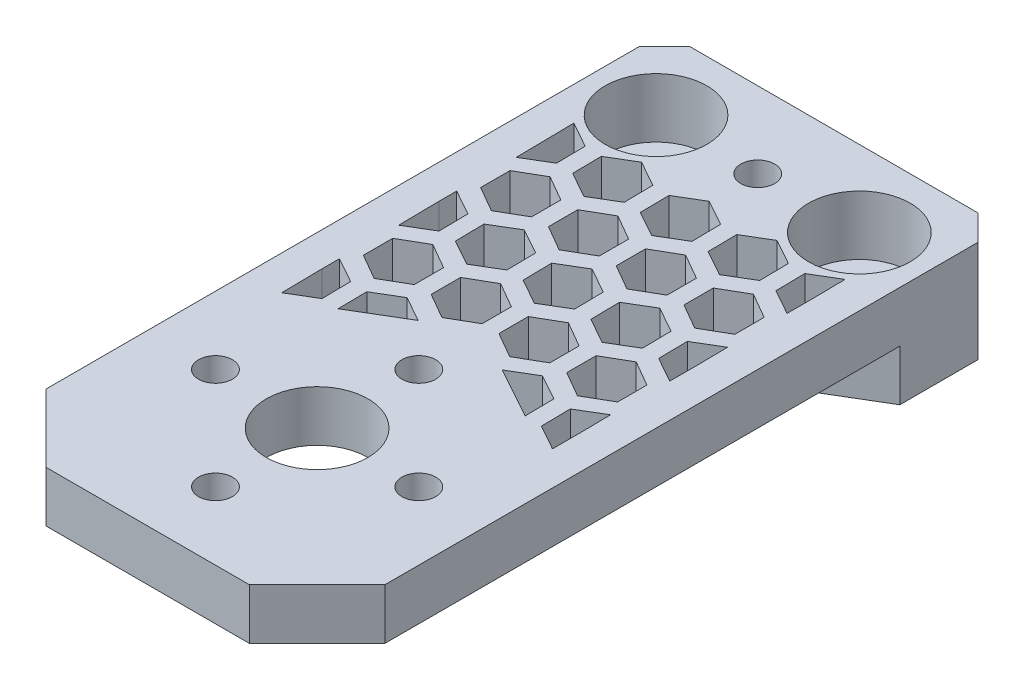
from build123d import *
from build123d.topology import SkipClean

# Parameters (mm, degrees)
SKETCH2_W                = 20
SKETCH2_H                = 44
SKETCH2_R                = 1.5
SKETCH2_R_2              = 3
SKETCH2_R_3              = 1
BOSS_EXTRUDE1_DEPTH      = 3
CHAMFER2_SIZE            = 4
BOSS_EXTRUDE3_START      = 3
SKETCH5_W                = 20
SKETCH5_H                = 12
SKETCH5_R                = 1.5
BOSS_EXTRUDE3_DEPTH      = 3
CHAMFER3_SIZE            = 5
CHAMFER4_SIZE            = 3.5
CHAMFER5_SIZE            = 2
SKETCH8_W                = 16
SKETCH8_H                = 3
BOSS_EXTRUDE4_DEPTH      = 3.5
CUT_EXTRUDE14_DEPTH      = 20.5
CUT_EXTRUDE12_DEPTH      = 20.5
CUT_EXTRUDE12_DEPTH_BACK = 3.5
SKETCH7_R                = 3
CUT_EXTRUDE13_DEPTH      = 3.5
CUT_EXTRUDE15_DEPTH      = 8.5
BOSS_EXTRUDE5_START      = 0.55
SKETCH11_R               = 2.4
SKETCH11_R_2             = 1.5
BOSS_EXTRUDE5_DEPTH      = 0.55


with BuildPart() as part:
    # Sketch2 → Boss-Extrude1 (new body)
    with BuildSketch(Plane(origin=(0, 0, 0), x_dir=(1, 0, 0), z_dir=(0, 1, 0))):
        with Locations((0, 12)):
            Rectangle(SKETCH2_W, SKETCH2_H)
        with Locations(Location((-6, 26, 0), (0, 0, 270))):
            Circle(SKETCH2_R, mode=Mode.SUBTRACT)
        with Locations(Location((6, 26, 0), (0, 0, 270))):
            Circle(SKETCH2_R, mode=Mode.SUBTRACT)
        with Locations(Location((0, 0, 0), (0, 0, 270))):
            Circle(SKETCH2_R_2, mode=Mode.SUBTRACT)
        with Locations(Location((0, 26, 0), (0, 0, 270))):
            Circle(SKETCH2_R_3, mode=Mode.SUBTRACT)
        with Locations(Location((-6, 0, 0), (0, 0, 270))):
            Circle(SKETCH2_R_3, mode=Mode.SUBTRACT)
        with Locations(Location((0, 6, 0), (0, 0, 270))):
            Circle(SKETCH2_R_3, mode=Mode.SUBTRACT)
        with Locations(Location((6, 0, 0), (0, 0, 270))):
            Circle(SKETCH2_R_3, mode=Mode.SUBTRACT)
        with Locations(Location((0, -6, 0), (0, 0, 270))):
            Circle(SKETCH2_R_3, mode=Mode.SUBTRACT)
    extrude(amount=BOSS_EXTRUDE1_DEPTH)

    # Chamfer2
    chamfer2_edges = [part.edges().sort_by_distance(p)[0] for p in [
        (10, 1.5, 10),
        (-10, 1.5, 10),
    ]]
    chamfer(chamfer2_edges, length=CHAMFER2_SIZE)

    # Sketch5 → Boss-Extrude3 (add)
    with SkipClean():  # the faces are left unmerged after this step: merging them gives an invalid solid
        with BuildSketch(Plane.XZ.offset(BOSS_EXTRUDE3_START)):
            with Locations((0, -28)):
                Rectangle(SKETCH5_W, SKETCH5_H)
            with Locations(Location((-6, -26, 0), (0, 0, 270))):
                Circle(SKETCH5_R, mode=Mode.SUBTRACT)
            with Locations(Location((6, -26, 0), (0, 0, 270))):
                Circle(SKETCH5_R, mode=Mode.SUBTRACT)
        extrude(amount=-BOSS_EXTRUDE3_DEPTH)

    # Chamfer3
    chamfer3_edges = [part.edges().sort_by_distance(p)[0] for p in [
        (-10, 1.5, -34),
        (10, 1.5, -34),
    ]]
    chamfer(chamfer3_edges, length=CHAMFER3_SIZE)

    # Chamfer4
    # the kernel refuses this chamfer: 3.5 mm, written as the material it takes off along each edge
    with BuildSketch(Plane(origin=(-14.000890458, 3, -34), x_dir=(0, 0.027495876610586372, 0.9996219169112968), z_dir=(1, 0, 0))) as chamfer4_piece_1:
        Polygon((CHAMFER4_SIZE * 0.999621916911, CHAMFER4_SIZE * 0.0274958766106), (-CHAMFER4_SIZE * 0.0274958766106, CHAMFER4_SIZE * 0.999621916911), (0, 0), align=None)
    extrude(amount=28.001780916, mode=Mode.SUBTRACT)

    # Chamfer5
    chamfer5_edges = [part.edges().sort_by_distance(p)[0] for p in [
        (-10, -1.5, -22),
        (10, -1.5, -22),
    ]]
    chamfer(chamfer5_edges, length=CHAMFER5_SIZE)

    # Sketch8 → Boss-Extrude4 (add)
    with BuildSketch(Plane.XY.offset(-22)):
        with Locations((0, -1.5)):
            Rectangle(SKETCH8_W, SKETCH8_H)
    extrude(amount=BOSS_EXTRUDE4_DEPTH)

    # Sketch9 → Cut-Extrude14 (cut)
    with BuildSketch(Plane(origin=(8, 0, 0), x_dir=(0, 0, -1), z_dir=(1, 0, 0))):
        Polygon((18.5, 0), (22, -3), (18.5, -3), align=None)
    extrude(amount=-CUT_EXTRUDE14_DEPTH, mode=Mode.SUBTRACT)

    # Sketch6 → Cut-Extrude12 (cut, two sides: drawn at the far end of the back side and taken through both)
    with BuildSketch(Plane.XZ.offset(-CUT_EXTRUDE12_DEPTH_BACK)):
        Polygon((7.974958559, -9.340270184), (8, -7.600608544), (8, -5.890509536), (6.512677497, -6.720778994), (6.487859457, -8.43719837), (6.487636056, -8.452648771), align=None)
        Polygon((-7.965068215, -19.71653063), (-8.015151096, -23.16468646), (-6.502787152, -22.320438095), (-6.477969112, -20.604018719), align=None)
        Polygon((-5.972485973, -16.256349599), (-7.472485973, -17.122375003), (-7.472485973, -18.854425811), (-5.972485973, -19.720451214), (-4.472485973, -18.854425811), (-4.472485973, -17.122375003), align=None)
        Polygon((-8, -15.196834392), (-8, -16.236228649), (-6.502787152, -15.400438095), (-6.477745712, -13.668568317), (-7.965068215, -12.780946905), align=None)
        Polygon((-5.482377331, -20.560778994), (-5.507195371, -22.27719837), (-4.020096269, -23.16468646), (-2.507732325, -22.320438095), (-2.482914284, -20.604018719), (-3.970013387, -19.71653063), align=None)
        Polygon((-0.472485973, -18.854425811), (-0.472485973, -17.122375003), (-1.972485973, -16.256349599), (-3.472485973, -17.122375003), (-3.472485973, -18.854425811), (-1.972485973, -19.720451214), align=None)
        Polygon((8, -21.440608545), (8, -19.730509537), (6.512677497, -20.560778994), (6.487859457, -22.27719837), (6.487636056, -22.292648772), (7.974958559, -23.180270185), align=None)
        Polygon((-8, -8.292418116), (-8, -9.316228649), (-6.502787152, -8.480438095), (-6.477969112, -6.764018718), (-7.965068215, -5.876530629), align=None)
        Polygon((-1.487322503, -20.560778994), (-1.512140543, -22.27719837), (-0.025041441, -23.16468646), (1.487322503, -22.320438095), (1.512140543, -20.604018719), (0.025041441, -19.71653063), align=None)
        Polygon((-0.025041441, -16.24468646), (1.487322503, -15.400438095), (1.512140543, -13.684018718), (0.025041441, -12.796530629), (-1.487322503, -13.640778994), (-1.512140543, -15.35719837), align=None)
        Polygon((0.527514027, -17.122375003), (0.527514027, -18.854425811), (2.027514027, -19.720451214), (3.527514027, -18.854425811), (3.527514027, -17.122375003), (2.027514027, -16.256349599), align=None)
        Polygon((5.487322503, -22.320438095), (5.512140543, -20.604018719), (4.025041441, -19.71653063), (2.512677497, -20.560778994), (2.487859457, -22.27719837), (3.974958559, -23.16468646), align=None)
        Polygon((6.027514027, -19.720451214), (7.527514027, -18.854425811), (7.527514027, -17.122375003), (6.027514027, -16.256349599), (4.527514027, -17.122375003), (4.527514027, -18.854425811), align=None)
        Polygon((7.974958559, -16.24468646), (8, -14.512816682), (8, -12.810509536), (6.512677497, -13.640778994), (6.487859457, -15.35719837), align=None)
        Polygon((5.512140543, -13.684018718), (4.025041441, -12.796530629), (2.512677497, -13.640778994), (2.487859457, -15.35719837), (3.974958559, -16.24468646), (5.487322503, -15.400438095), align=None)
        Polygon((-2.482914284, -13.684018718), (-3.970013387, -12.796530629), (-5.482377331, -13.640778994), (-5.507195371, -15.35719837), (-4.020096269, -16.24468646), (-2.507732325, -15.400438095), align=None)
        Polygon((3.527514027, -10.202375003), (2.027514027, -9.336349599), (0.527514027, -10.202375003), (0.527514027, -11.934425811), (2.027514027, -12.800451214), (3.527514027, -11.934425811), align=None)
        Polygon((7.527514027, -10.202375003), (6.027514027, -9.336349599), (4.527514027, -10.202375003), (4.527514027, -11.934425811), (6.027514027, -12.800451214), (7.527514027, -11.934425811), align=None)
        Polygon((-2.521224465, -8.487969825), (-5.482377331, -6.720778994), (-5.507195371, -8.43719837), (-4.020096269, -9.32468646), align=None)
        Polygon((2.487636056, -8.437065047), (3.974958559, -9.32468646), (5.487322503, -8.480438095), (5.512136799, -6.76427767), align=None)
        Polygon((-0.472485973, -10.202375003), (-1.972485973, -9.336349599), (-3.472485973, -10.202375003), (-3.472485973, -11.934425811), (-1.972485973, -12.800451214), (-0.472485973, -11.934425811), align=None)
        Polygon((-4.472485973, -10.202375003), (-5.972485973, -9.336349599), (-7.472485973, -10.202375003), (-7.472485973, -11.934425811), (-5.972485973, -12.800451214), (-4.472485973, -11.934425811), align=None)
    extrude(amount=CUT_EXTRUDE12_DEPTH + CUT_EXTRUDE12_DEPTH_BACK, mode=Mode.SUBTRACT)

    # Sketch7 → Cut-Extrude13 (cut)
    with BuildSketch(Plane(origin=(0, 3, 0), x_dir=(1, 0, 0), z_dir=(0, 1, 0))):
        with Locations(Location((-6, 26, 0), (0, 0, 270))):
            Circle(SKETCH7_R)
        with Locations(Location((6, 26, 0), (0, 0, 270))):
            Circle(SKETCH7_R)
    extrude(amount=-CUT_EXTRUDE13_DEPTH, mode=Mode.SUBTRACT)

    # Sketch10 → Cut-Extrude15 (cut)
    with BuildSketch(Plane.XZ):
        Polygon((-8.015151096, -23.16468646), (-10.750887567, -24.691859236), (-10.750887567, -21.793055284), (-10.750887567, -19.71653063), (-7.965068215, -19.71653063), (-7.692749293, -21.793055284), align=None)
        Polygon((7.974958559, -23.180270185), (10.435476206, -24.648686177), (10.435476206, -19.313294589), (8, -19.730509537), (7.329774539, -21.01583879), align=None)
    extrude(amount=CUT_EXTRUDE15_DEPTH, mode=Mode.SUBTRACT)

    # Sketch11 → Boss-Extrude5 (add)
    # profile 1 of 2: a face of its own
    with BuildSketch(Plane.XZ.offset(3).offset(BOSS_EXTRUDE5_START)):
        with Locations(Location((-6, -26, 0), (0, 0, 90))):
            Circle(SKETCH11_R)
        with Locations(Location((-6, -26, 0), (0, 0, 270))):
            Circle(SKETCH11_R_2, mode=Mode.SUBTRACT)
    # profile 2 of 2: a face of its own
    with BuildSketch(Plane.XZ.offset(3).offset(BOSS_EXTRUDE5_START)):
        with Locations(Location((6, -26, 0), (0, 0, 90))):
            Circle(SKETCH11_R)
        with Locations(Location((6, -26, 0), (0, 0, 270))):
            Circle(SKETCH11_R_2, mode=Mode.SUBTRACT)
    extrude(amount=-BOSS_EXTRUDE5_DEPTH)


solid = part.part
